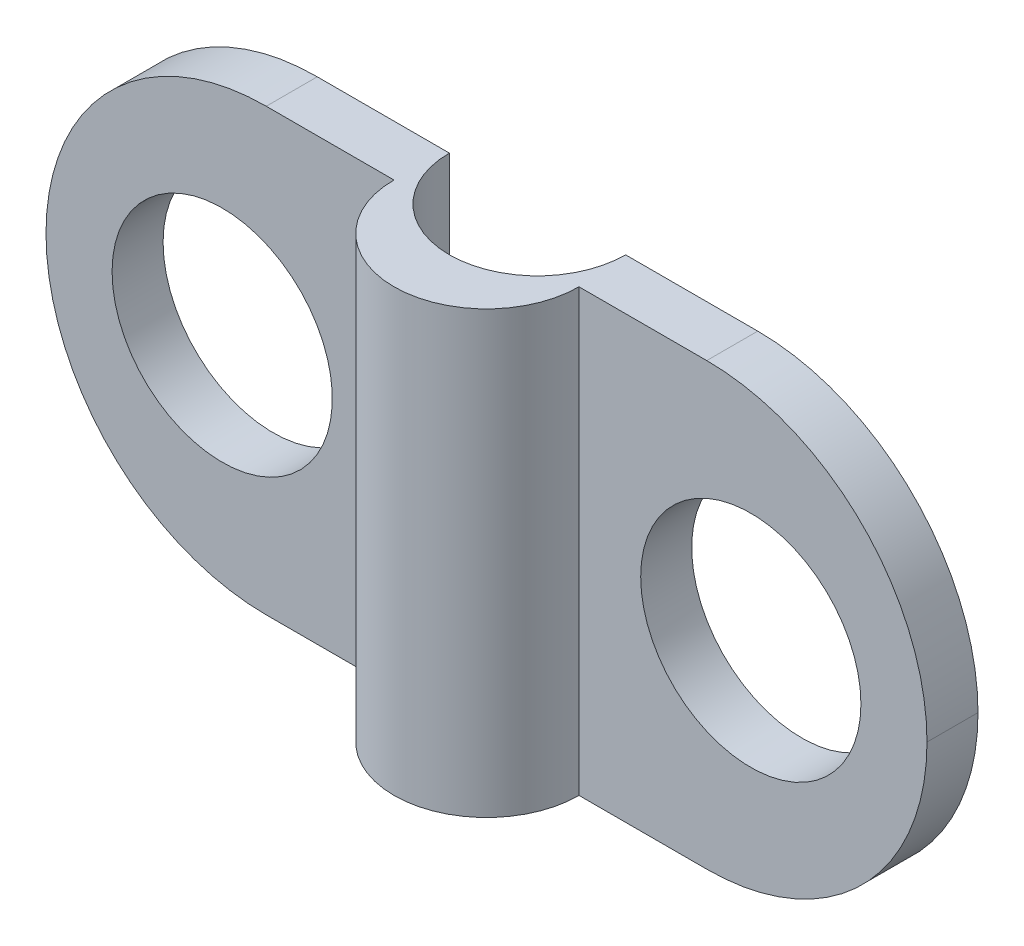
from build123d import *

# Parameters (mm, degrees)
SZKIC1_W                    = 20
SZKIC1_H                    = 10
DODANIE_WYCI_GNI_CIE1_DEPTH = 10
SZKIC2_R                    = 2.5
WYTNIJ_WYCI_GNI_CIE1_DEPTH  = 10
WYTNIJ_WYCI_GNI_CIE2_DEPTH  = 10
WYTNIJ_WYCI_GNI_CIE3_DEPTH  = 10
ZAOKR_GLENIE2_R             = 5


with BuildPart() as part:
    # Szkic1 → Dodanie-wyciągnięcie1 (new body)
    with BuildSketch(Plane.XY):
        Rectangle(SZKIC1_W, SZKIC1_H)
    extrude(amount=DODANIE_WYCI_GNI_CIE1_DEPTH)

    # Szkic2 → Wytnij-wyciągnięcie1 (cut)
    with BuildSketch(Plane.XY.offset(10)):
        with Locations((-6, 0)):
            Circle(SZKIC2_R)
        with Locations((6, 0)):
            Circle(SZKIC2_R)
    extrude(amount=-WYTNIJ_WYCI_GNI_CIE1_DEPTH, mode=Mode.SUBTRACT)

    # Szkic3 → Wytnij-wyciągnięcie2 (cut)
    with BuildSketch(Plane.XZ.offset(5)):
        with BuildLine():
            Line((-10, 10), (-10, 2.729686207))
            Line((-10, 2.729686207), (-2.1, 2.729686207))
            ThreePointArc((-2.1, 2.729686207), (0, 4.829686207), (2.1, 2.729686207))
            Line((2.1, 2.729686207), (10, 2.729686207))
            Line((10, 2.729686207), (10, 10))
            Line((10, 10), (-10, 10))
        make_face()
    extrude(amount=-WYTNIJ_WYCI_GNI_CIE2_DEPTH, mode=Mode.SUBTRACT)

    # Szkic3<3> → Wytnij-wyciągnięcie3 (cut)
    with BuildSketch(Plane.XZ.offset(5)):
        with BuildLine():
            Line((-2, 1.571944273), (-10, 1.571944273))
            Line((-10, 1.571944273), (-10, 0))
            Line((-10, 0), (10, 0))
            Line((10, 0), (10, 1.571944273))
            Line((10, 1.571944273), (2, 1.571944273))
            ThreePointArc((2, 1.571944273), (0, 3.571944273), (-2, 1.571944273))
        make_face()
    extrude(amount=-WYTNIJ_WYCI_GNI_CIE3_DEPTH, mode=Mode.SUBTRACT)

    # Zaokrąglenie2
    zaokr_glenie2_edges = [part.edges().sort_by_distance(p)[0] for p in [
        (10, 5, 2.15081524),
        (10, -5, 2.15081524),
        (-10, 5, 2.15081524),
        (-10, -5, 2.15081524),
    ]]
    fillet(zaokr_glenie2_edges, radius=ZAOKR_GLENIE2_R - 0.0001)  # a hair under: the kernel refuses the full size


solid = part.part
